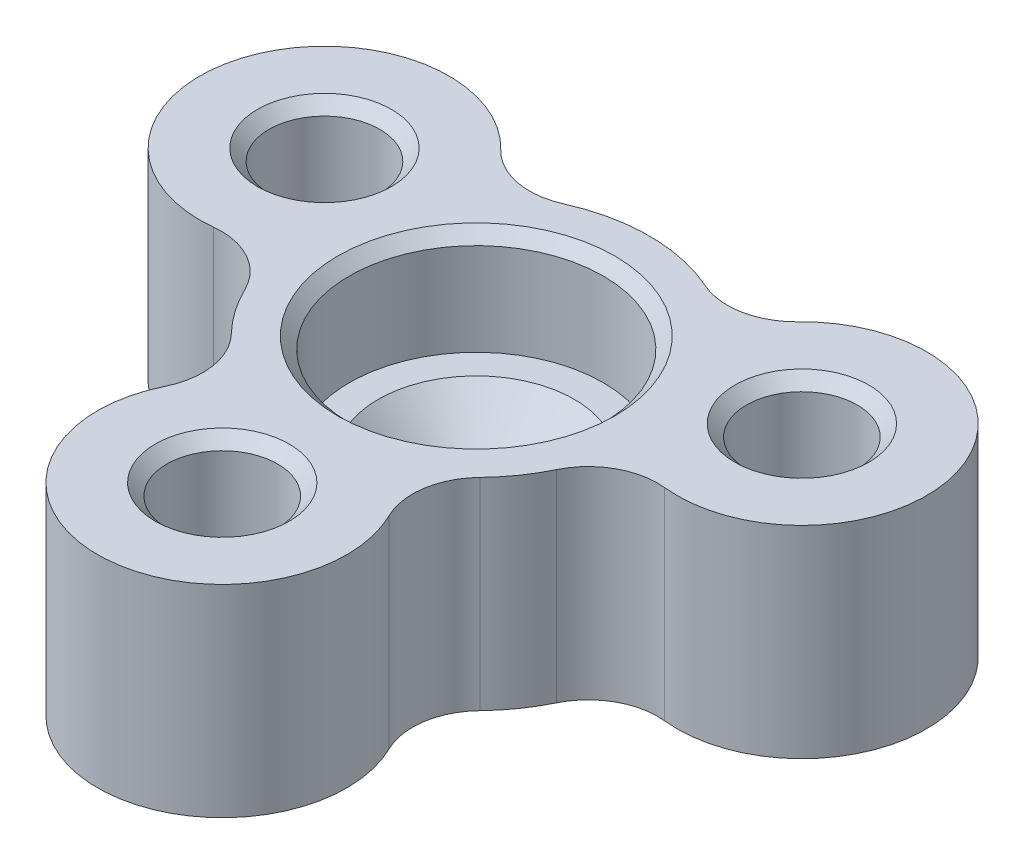
from build123d import *

# Parameters (mm, degrees)
SKETCH1_R                      = 1.7
BOSS_EXTRUDE1_DEPTH            = 8.74825
F_4_8_4_8_DIAMETER_HOLE1_D     = 4.8
F_4_8_4_8_DIAMETER_HOLE1_DEPTH = 6.4
F_4_8_4_8_DIAMETER_HOLE1_TIP   = 1.442065486
CHANFREIN3_SIZE                = 0.5
FILLET1_R                      = 3
CHANFREIN2_SIZE                = 2


with BuildPart() as part:
    # Sketch1 → Boss-Extrude1 (new body)
    with BuildSketch(Plane(origin=(0, 0, 0), x_dir=(1, 0, 0), z_dir=(0, 1, 0))):
        with BuildLine():
            ThreePointArc((-3.307377147, -6.731363636), (0, -16.4), (3.307377147, -6.731363636))
            ThreePointArc((3.307377147, -6.731363636), (6.143640332, -4.301823273), (7.456602343, -0.805655944))
            ThreePointArc((7.456602343, -0.805655944), (15.410958981, 5.609130351), (5.194223131, 5.410179855))
            ThreePointArc((5.194223131, 5.410179855), (0, 7.5), (-5.194223131, 5.410179855))
            ThreePointArc((-5.194223131, 5.410179855), (-15.410958981, 5.609130351), (-7.456602343, -0.805655944))
            ThreePointArc((-7.456602343, -0.805655944), (-6.143640332, -4.301823273), (-3.307377147, -6.731363636))
        make_face()
        with Locations(Location((0, -11, 0), (0, 0, 270))):
            Circle(SKETCH1_R, mode=Mode.SUBTRACT)
        with Locations(Location((-10.336618829, 3.762221577, 0), (0, 0, 270))):
            Circle(SKETCH1_R, mode=Mode.SUBTRACT)
        with Locations(Location((10.336618829, 3.762221577, 0), (0, 0, 270))):
            Circle(SKETCH1_R, mode=Mode.SUBTRACT)
    extrude(amount=-BOSS_EXTRUDE1_DEPTH)

    # Ø4.8 (4.8) Diameter Hole1
    with Locations(Plane(origin=(0, 0, 0), x_dir=(1, 0, 0), z_dir=(0, 1, 0))):
        with Locations((-10.336618829, 3.762221577), (10.336618829, 3.762221577), (0, -11)):
            Hole(F_4_8_4_8_DIAMETER_HOLE1_D / 2, depth=F_4_8_4_8_DIAMETER_HOLE1_DEPTH)
            with Locations((0, 0, -(F_4_8_4_8_DIAMETER_HOLE1_DEPTH + F_4_8_4_8_DIAMETER_HOLE1_TIP / 2))):  # 118° drill point
                Cone(0, F_4_8_4_8_DIAMETER_HOLE1_D / 2, F_4_8_4_8_DIAMETER_HOLE1_TIP, mode=Mode.SUBTRACT)

    # Chanfrein3
    chanfrein3_edges = [part.edges().sort_by_distance(p)[0] for p in [
        (2.4, 0, 11),
        (12.736618829, 0, -3.762221577),
        (-7.936618829, 0, -3.762221577),
    ]]
    chamfer(chanfrein3_edges, length=CHANFREIN3_SIZE)

    # Sketch2 → Cut-Revolve1 (revolve, cut)
    with BuildSketch(Plane(origin=(0, 0, 0), x_dir=(0, 0, -1), z_dir=(1, 0, 0)), mode=Mode.PRIVATE) as cut_revolve1_sk:
        Polygon((0, 0), (6, 0), (5.5, -0.5), (5.5, -4.5), (4.25, -4.5), (4.25, -6.5), (0, -6.5), align=None)
    revolve(cut_revolve1_sk.sketch.rotate(Axis((0, 1.69902052, 0), (0, -1, 0)), 180), axis=Axis((0, 1.69902052, 0), (0, -1, 0)), mode=Mode.SUBTRACT)

    # Fillet1
    fillet1_edges = [part.edges().sort_by_distance(p)[0] for p in [
        (3.307377147, -4.374125, 6.731363636),
        (-3.307377147, -4.374125, 6.731363636),
        (-7.456602343, -4.374125, 0.805655944),
        (-5.194223131, -4.374125, -5.410179855),
        (5.194223131, -4.374125, -5.410179855),
        (7.456602343, -4.374125, 0.805655944),
    ]]
    fillet(fillet1_edges, radius=FILLET1_R)

    # Chanfrein2
    chanfrein2_edges = [part.edges().sort_by_distance(p)[0] for p in [
        (0, -6.5, -4.25),
    ]]
    chamfer(chanfrein2_edges, length=CHANFREIN2_SIZE - 0.0001)  # a hair under: the kernel refuses the full size


solid = part.part
